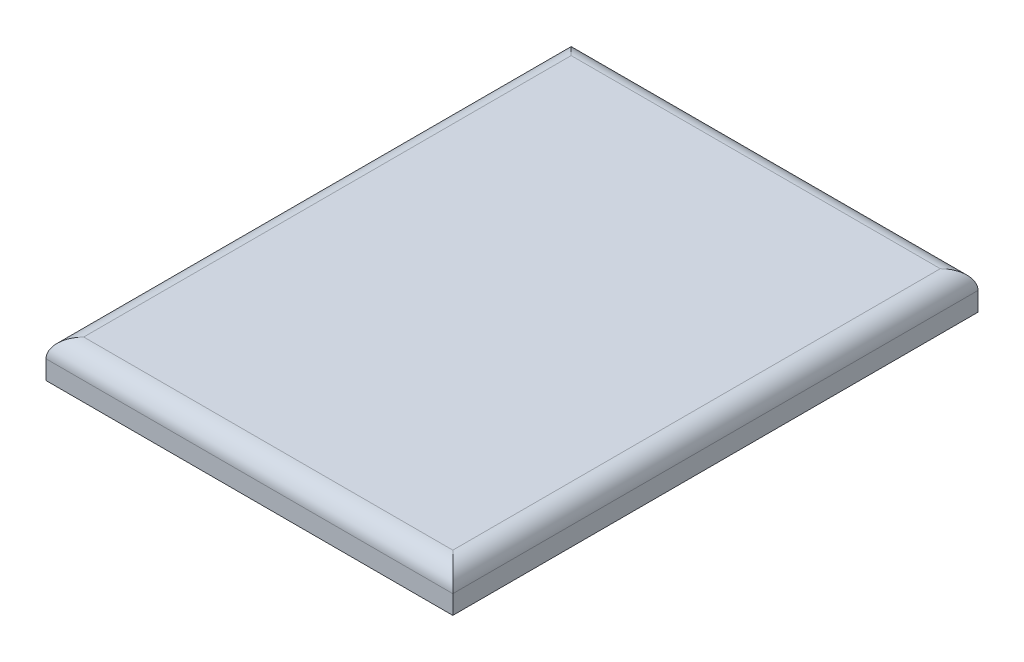
from build123d import *

# Parameters (mm, degrees)
SKETCH1_W           = 431.8
SKETCH1_H           = 557.4328891
BOSS_EXTRUDE1_DEPTH = 40
FILLET1_START       = -215.9
FILLET1_DEPTH       = 431.8
FILLET1_START_2     = -280
FILLET1_2_DEPTH     = 560


with BuildPart() as part:
    # Sketch1 → Boss-Extrude1 (new body)
    with BuildSketch(Plane(origin=(0, 0, 0), x_dir=(1, 0, 0), z_dir=(0, 1, 0))):
        Rectangle(SKETCH1_W, SKETCH1_H)
    extrude(amount=BOSS_EXTRUDE1_DEPTH)

    # Fillet1: read off the stored shape, not the designer's step
    # Fillet1 outline → Fillet1 (cut)
    with BuildSketch(Plane.YZ.offset(FILLET1_START)):
        with BuildLine():
            Line((40, -278.71644455), (40, -258.71644455))
            ThreePointArc((40, -258.71644455), (34.142135624, -272.858580174), (20, -278.71644455))
            Line((20, -278.71644455), (40, -278.71644455))
        make_face()
        with BuildLine():
            ThreePointArc((20, 278.71644455), (34.142135624, 272.858580174), (40, 258.71644455))
            Line((40, 258.71644455), (40, 278.71644455))
            Line((40, 278.71644455), (20, 278.71644455))
        make_face()
    extrude(amount=FILLET1_DEPTH, mode=Mode.SUBTRACT)

    # Fillet1 2 outline → Fillet1 2 (cut)
    with BuildSketch(Plane.XY.offset(FILLET1_START_2)):
        with BuildLine():
            Line((215.9, 40), (195.9, 40))
            ThreePointArc((195.9, 40), (210.042135624, 34.142135624), (215.9, 20))
            Line((215.9, 20), (215.9, 40))
        make_face()
        with BuildLine():
            ThreePointArc((-215.9, 20), (-210.042135624, 34.142135624), (-195.9, 40))
            Line((-195.9, 40), (-215.9, 40))
            Line((-215.9, 40), (-215.9, 20))
        make_face()
    extrude(amount=FILLET1_2_DEPTH, mode=Mode.SUBTRACT)


solid = part.part
